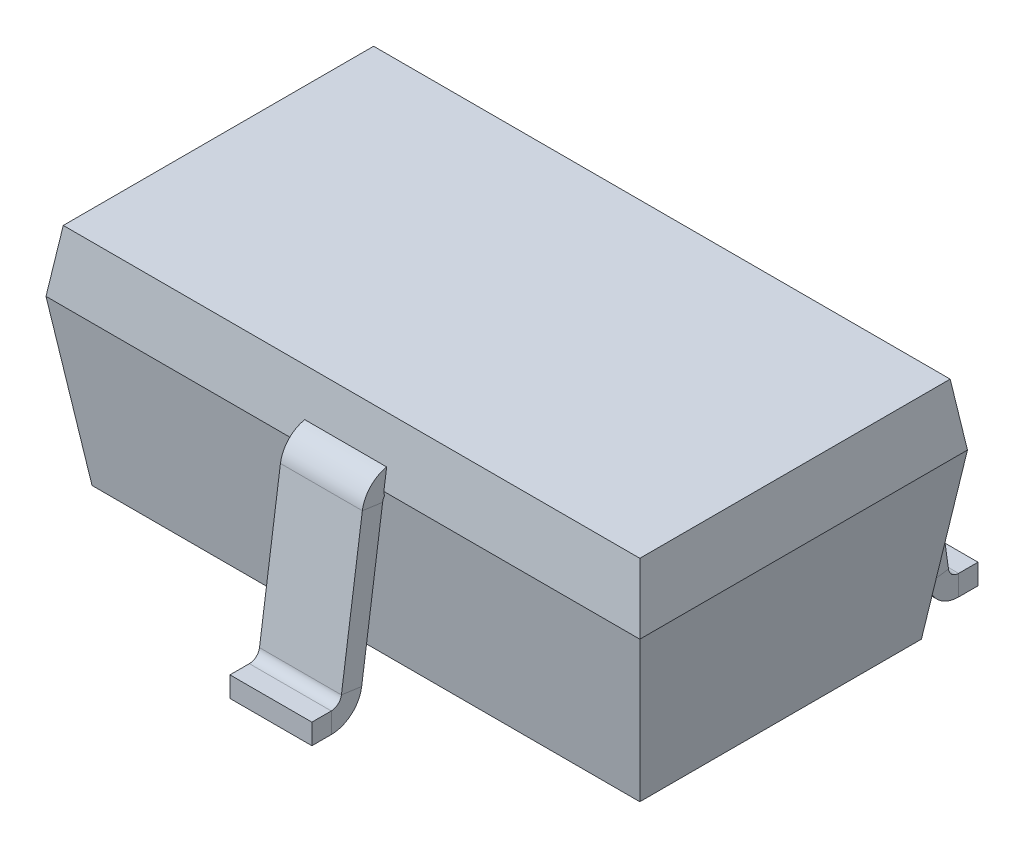
from build123d import *

# Parameters (mm, degrees)
SKETCH1_W                     = 2.9
SKETCH1_H                     = 1.6
BOSS_EXTRUDE1_DEPTH           = 0.3
BOSS_EXTRUDE1_TAPER           = 8
BOSS_EXTRUDE1_OTHER_WAY_DEPTH = 0.8
BOSS_EXTRUDE1_OTHER_WAY_TAPER = 8
BASE_FLANGE2_DEPTH            = 0.2
BASE_FLANGE3_DEPTH            = 0.2


# Sheet-metal steps are written as plain solids
with BuildPart() as part:
    # Sketch1 → Boss-Extrude1 (new body)
    with BuildSketch(Plane(origin=(0, 0, 0), x_dir=(1, 0, 0), z_dir=(0, 1, 0))):
        Rectangle(SKETCH1_W, SKETCH1_H)
    extrude(amount=BOSS_EXTRUDE1_DEPTH, taper=BOSS_EXTRUDE1_TAPER)

    # Sketch1 → Boss-Extrude1 other way (add)
    with BuildSketch(Plane(origin=(0, 0, 0), x_dir=(1, 0, 0), z_dir=(0, 1, 0))):
        Rectangle(SKETCH1_W, SKETCH1_H)
    extrude(amount=-BOSS_EXTRUDE1_OTHER_WAY_DEPTH, taper=BOSS_EXTRUDE1_OTHER_WAY_TAPER)


with BuildPart() as body_2:
    # Sketch2 → Base-Flange2 (new, symmetric)
    with BuildSketch(Plane.ZY):
        with BuildLine():
            Line((0.6, 0), (0.756535663, 0))
            ThreePointArc((0.756535663, 0), (0.789338615, -0.012264521), (0.806049067, -0.043041345))
            Line((0.806049067, -0.043041345), (0.908339552, -0.770875965))
            ThreePointArc((0.908339552, -0.770875965), (0.958470908, -0.863206437), (1.056879762, -0.9))
            Line((1.056879762, -0.9), (1.151486751, -0.9))
            Line((1.151486751, -0.9), (1.151486751, -0.8))
            Line((1.151486751, -0.8), (1.056879762, -0.8))
            ThreePointArc((1.056879762, -0.8), (1.02407681, -0.787735479), (1.007366358, -0.756958655))
            Line((1.007366358, -0.756958655), (0.905075873, -0.029124035))
            ThreePointArc((0.905075873, -0.029124035), (0.854944517, 0.063206437), (0.756535663, 0.1))
            Line((0.756535663, 0.1), (0.6, 0.1))
            Line((0.6, 0.1), (0.6, 0))
        make_face()
    extrude(amount=BASE_FLANGE2_DEPTH, both=True)


with BuildPart() as body_3:
    # Sketch11 → Base-Flange3 (new, symmetric)
    with BuildSketch(Plane.ZY.offset(0.95)):
        with BuildLine():
            Line((-0.69, 0), (-0.756535663, 0))
            ThreePointArc((-0.756535663, 0), (-0.789338615, -0.012264521), (-0.806049067, -0.043041345))
            Line((-0.806049067, -0.043041345), (-0.908339552, -0.770875965))
            ThreePointArc((-0.908339552, -0.770875965), (-0.958470908, -0.863206437), (-1.056879762, -0.9))
            Line((-1.056879762, -0.9), (-1.151486751, -0.9))
            Line((-1.151486751, -0.9), (-1.151486751, -0.8))
            Line((-1.151486751, -0.8), (-1.056879762, -0.8))
            ThreePointArc((-1.056879762, -0.8), (-1.02407681, -0.787735479), (-1.007366358, -0.756958655))
            Line((-1.007366358, -0.756958655), (-0.905075873, -0.029124035))
            ThreePointArc((-0.905075873, -0.029124035), (-0.854944517, 0.063206437), (-0.756535663, 0.1))
            Line((-0.756535663, 0.1), (-0.69, 0.1))
            Line((-0.69, 0.1), (-0.69, 0))
        make_face()
    extrude(amount=BASE_FLANGE3_DEPTH, both=True)


with BuildPart() as body_4:
    # Mirror1: mirrored copy
    add(body_3.part.mirror(Plane.ZY))


solid = Compound([part.part, body_2.part, body_3.part, body_4.part])
